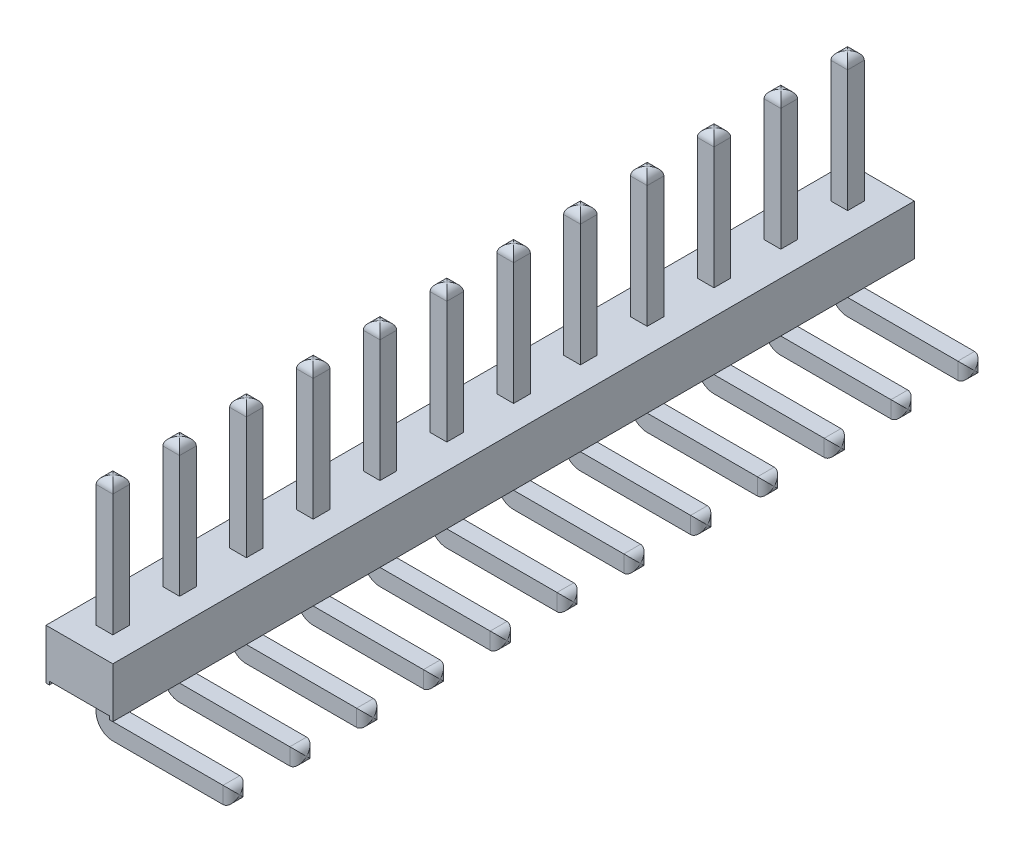
from build123d import *

# Parameters (mm, degrees)
BOSS_EXTRUDE1_DEPTH = 24
BOSS_EXTRUDE2_DEPTH = 3.9
FILLET1_R           = 0.25
SKETCH3_W           = 0.5
SKETCH3_H           = 0.501157684
BOSS_EXTRUDE3_DEPTH = 1.35
SKETCH5_W           = 0.501157684
SKETCH5_H           = 0.5
BOSS_EXTRUDE5_DEPTH = 3.55
FILLET4_R           = 0.25
FILLET5_R           = 0.5


with BuildPart() as part:
    # Sketch1 → Boss-Extrude1 (new body)
    with BuildSketch(Plane.XY):
        Polygon((0.1, -1.5), (0.1, -1.399682434), (1.901861327, -1.399682434), (1.901861327, -1.5), (2, -1.5), (2, 0), (0, 0), (0, -1.5), align=None)
    extrude(amount=-BOSS_EXTRUDE1_DEPTH)

    # Sketch2 → Boss-Extrude2 (add)
    with BuildSketch(Plane(origin=(0, 0, 0), x_dir=(1, 0, 0), z_dir=(0, 1, 0))):
        Polygon((1, 23.25), (0.75, 23.25), (0.75, 22.75), (1, 22.75), (1.25, 22.75), (1.25, 23.25), align=None)
        Polygon((0.75, 20.75), (1, 20.75), (1.25, 20.75), (1.25, 21.25), (1, 21.25), (0.75, 21.25), align=None)
        Polygon((0.75, 18.75), (1, 18.75), (1.25, 18.75), (1.25, 19.25), (1, 19.25), (0.75, 19.25), align=None)
        Polygon((0.75, 16.75), (1, 16.75), (1.25, 16.75), (1.25, 17.25), (1, 17.25), (0.75, 17.25), align=None)
        Polygon((0.75, 14.75), (1, 14.75), (1.25, 14.75), (1.25, 15.25), (1, 15.25), (0.75, 15.25), align=None)
        Polygon((0.75, 12.75), (1, 12.75), (1.25, 12.75), (1.25, 13.25), (1, 13.25), (0.75, 13.25), align=None)
        Polygon((0.75, 10.75), (1, 10.75), (1.25, 10.75), (1.25, 11.25), (1, 11.25), (0.75, 11.25), align=None)
        Polygon((0.75, 8.75), (1, 8.75), (1.25, 8.75), (1.25, 9.25), (1, 9.25), (0.75, 9.25), align=None)
        Polygon((0.75, 6.75), (1, 6.75), (1.25, 6.75), (1.25, 7.25), (1, 7.25), (0.75, 7.25), align=None)
        Polygon((0.75, 4.75), (1, 4.75), (1.25, 4.75), (1.25, 5.25), (1, 5.25), (0.75, 5.25), align=None)
        Polygon((0.75, 2.75), (1, 2.75), (1.25, 2.75), (1.25, 3.25), (1, 3.25), (0.75, 3.25), align=None)
        Polygon((0.75, 0.75), (1, 0.75), (1.25, 0.75), (1.25, 1.25), (1, 1.25), (0.75, 1.25), align=None)
    extrude(amount=BOSS_EXTRUDE2_DEPTH)

    # Fillet1
    fillet1_edges = [part.edges().sort_by_distance(p)[0] for p in [
        (1.25, 3.9, -11),
        (1, 3.9, -9.25),
        (0.75, 3.9, -9),
        (1, 3.9, -8.75),
        (1.25, 3.9, -9),
        (1, 3.9, -7.25),
        (0.75, 3.9, -7),
        (1, 3.9, -6.75),
        (1.25, 3.9, -7),
        (1, 3.9, -5.25),
        (0.75, 3.9, -5),
        (1, 3.9, -4.75),
        (1.25, 3.9, -5),
        (1, 3.9, -3.25),
        (0.75, 3.9, -3),
        (1, 3.9, -2.75),
        (1.25, 3.9, -3),
        (1, 3.9, -1.25),
        (0.75, 3.9, -1),
        (1, 3.9, -0.75),
        (1.25, 3.9, -1),
        (1, 3.9, -23.25),
        (0.75, 3.9, -23),
        (1, 3.9, -22.75),
        (1.25, 3.9, -23),
        (1, 3.9, -21.25),
        (0.75, 3.9, -21),
        (1, 3.9, -20.75),
        (1.25, 3.9, -21),
        (1, 3.9, -19.25),
        (0.75, 3.9, -19),
        (1, 3.9, -18.75),
        (1.25, 3.9, -19),
        (1, 3.9, -17.25),
        (0.75, 3.9, -17),
        (1, 3.9, -16.75),
        (1.25, 3.9, -17),
        (1, 3.9, -15.25),
        (0.75, 3.9, -15),
        (1, 3.9, -14.75),
        (1.25, 3.9, -15),
        (1, 3.9, -13.25),
        (0.75, 3.9, -13),
        (1, 3.9, -12.75),
        (1.25, 3.9, -13),
        (1, 3.9, -11.25),
        (0.75, 3.9, -11),
        (1, 3.9, -10.75),
    ]]
    fillet(fillet1_edges, radius=FILLET1_R - 0.0001)  # a hair under: the kernel refuses the full size

    # Sketch3 → Boss-Extrude3 (add)
    with BuildSketch(Plane(origin=(0, -1.399682434, 0), x_dir=(-1, 0, 0), z_dir=(0, -1, 0))):
        with Locations((-1.000930663, 21)):
            Rectangle(SKETCH3_W, SKETCH3_H)
        with Locations((-1.000930663, 23)):
            Rectangle(SKETCH3_W, SKETCH3_H)
        with Locations((-1.000930663, 19)):
            Rectangle(SKETCH3_W, SKETCH3_H)
        with Locations((-1.000930663, 17)):
            Rectangle(SKETCH3_W, SKETCH3_H)
        with Locations((-1.000930663, 15)):
            Rectangle(SKETCH3_W, SKETCH3_H)
        with Locations((-1.000930663, 13)):
            Rectangle(SKETCH3_W, SKETCH3_H)
        with Locations((-1.000930663, 11)):
            Rectangle(SKETCH3_W, SKETCH3_H)
        with Locations((-1.000930663, 9)):
            Rectangle(SKETCH3_W, SKETCH3_H)
        with Locations((-1.000930663, 7)):
            Rectangle(SKETCH3_W, SKETCH3_H)
        with Locations((-1.000930663, 5)):
            Rectangle(SKETCH3_W, SKETCH3_H)
        with Locations((-1.000930663, 3)):
            Rectangle(SKETCH3_W, SKETCH3_H)
        with Locations((-1.000930663, 1)):
            Rectangle(SKETCH3_W, SKETCH3_H)
    extrude(amount=BOSS_EXTRUDE3_DEPTH)

    # Sketch5 → Boss-Extrude5 (add)
    with BuildSketch(Plane(origin=(1.250930663, 0, 0), x_dir=(0, 0, -1), z_dir=(1, 0, 0))):
        with Locations((1, -2.499682434)):
            Rectangle(SKETCH5_W, SKETCH5_H)
        with Locations((3, -2.499682434)):
            Rectangle(SKETCH5_W, SKETCH5_H)
        with Locations((5, -2.499682434)):
            Rectangle(SKETCH5_W, SKETCH5_H)
        with Locations((7, -2.499682434)):
            Rectangle(SKETCH5_W, SKETCH5_H)
        with Locations((9, -2.499682434)):
            Rectangle(SKETCH5_W, SKETCH5_H)
        with Locations((11, -2.499682434)):
            Rectangle(SKETCH5_W, SKETCH5_H)
        with Locations((13, -2.499682434)):
            Rectangle(SKETCH5_W, SKETCH5_H)
        with Locations((15, -2.499682434)):
            Rectangle(SKETCH5_W, SKETCH5_H)
        with Locations((17, -2.499682434)):
            Rectangle(SKETCH5_W, SKETCH5_H)
        with Locations((19, -2.499682434)):
            Rectangle(SKETCH5_W, SKETCH5_H)
        with Locations((21, -2.499682434)):
            Rectangle(SKETCH5_W, SKETCH5_H)
        with Locations((23, -2.499682434)):
            Rectangle(SKETCH5_W, SKETCH5_H)
    extrude(amount=BOSS_EXTRUDE5_DEPTH)

    # Fillet4
    fillet4_edges = [part.edges().sort_by_distance(p)[0] for p in [
        (4.800930663, -2.499682434, -0.749421158),
        (4.800930663, -2.749682434, -1),
        (4.800930663, -2.499682434, -1.250578842),
        (4.800930663, -2.249682434, -1),
        (4.800930663, -2.749682434, -3),
        (4.800930663, -2.499682434, -3.250578842),
        (4.800930663, -2.249682434, -3),
        (4.800930663, -2.499682434, -2.749421158),
        (4.800930663, -2.749682434, -5),
        (4.800930663, -2.499682434, -5.250578842),
        (4.800930663, -2.249682434, -5),
        (4.800930663, -2.499682434, -4.749421158),
        (4.800930663, -2.749682434, -7),
        (4.800930663, -2.499682434, -7.250578842),
        (4.800930663, -2.249682434, -7),
        (4.800930663, -2.499682434, -6.749421158),
        (4.800930663, -2.749682434, -9),
        (4.800930663, -2.499682434, -9.250578842),
        (4.800930663, -2.249682434, -9),
        (4.800930663, -2.499682434, -8.749421158),
        (4.800930663, -2.749682434, -11),
        (4.800930663, -2.499682434, -11.250578842),
        (4.800930663, -2.249682434, -11),
        (4.800930663, -2.499682434, -10.749421158),
        (4.800930663, -2.749682434, -13),
        (4.800930663, -2.499682434, -13.250578842),
        (4.800930663, -2.249682434, -13),
        (4.800930663, -2.499682434, -12.749421158),
        (4.800930663, -2.749682434, -15),
        (4.800930663, -2.499682434, -15.250578842),
        (4.800930663, -2.249682434, -15),
        (4.800930663, -2.499682434, -14.749421158),
        (4.800930663, -2.749682434, -17),
        (4.800930663, -2.499682434, -17.250578842),
        (4.800930663, -2.249682434, -17),
        (4.800930663, -2.499682434, -16.749421158),
        (4.800930663, -2.749682434, -19),
        (4.800930663, -2.499682434, -19.250578842),
        (4.800930663, -2.249682434, -19),
        (4.800930663, -2.499682434, -18.749421158),
        (4.800930663, -2.749682434, -21),
        (4.800930663, -2.499682434, -21.250578842),
        (4.800930663, -2.249682434, -21),
        (4.800930663, -2.499682434, -20.749421158),
        (4.800930663, -2.749682434, -23),
        (4.800930663, -2.499682434, -23.250578842),
        (4.800930663, -2.249682434, -23),
        (4.800930663, -2.499682434, -22.749421158),
    ]]
    fillet(fillet4_edges, radius=FILLET4_R - 0.0001)  # a hair under: the kernel refuses the full size

    # Fillet5
    fillet5_edges = [part.edges().sort_by_distance(p)[0] for p in [
        (0.750930663, -2.749682434, -23),
        (0.750930663, -2.749682434, -21),
        (0.750930663, -2.749682434, -19),
        (0.750930663, -2.749682434, -17),
        (0.750930663, -2.749682434, -15),
        (0.750930663, -2.749682434, -13),
        (0.750930663, -2.749682434, -11),
        (0.750930663, -2.749682434, -9),
        (0.750930663, -2.749682434, -7),
        (0.750930663, -2.749682434, -5),
        (0.750930663, -2.749682434, -3),
        (0.750930663, -2.749682434, -1),
    ]]
    fillet(fillet5_edges, radius=FILLET5_R)


solid = part.part
